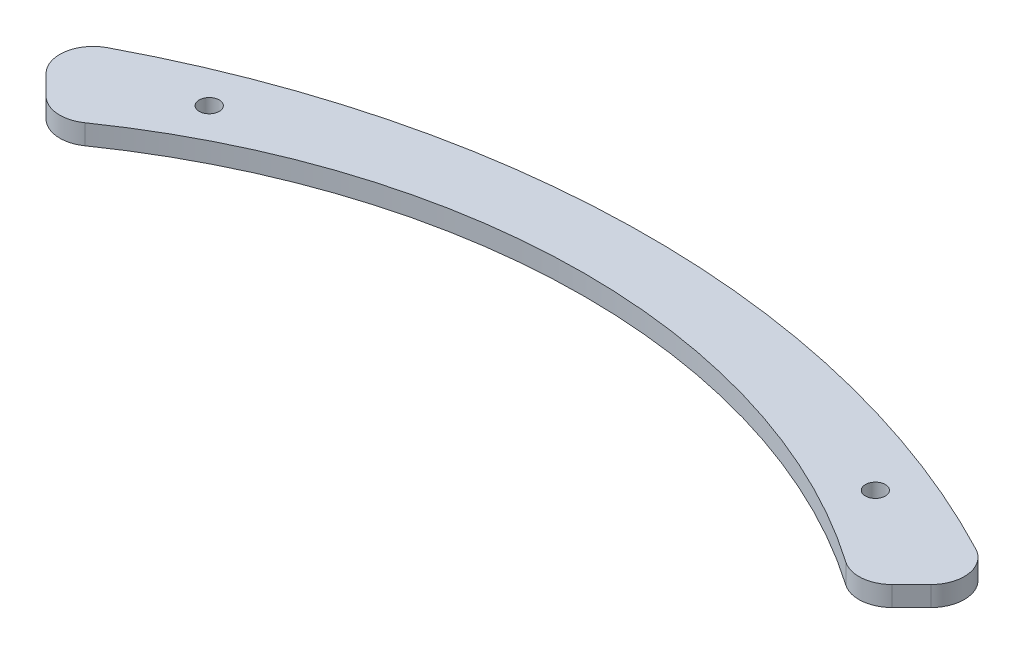
from build123d import *

# Parameters (mm, degrees)
BOSS_EXTRUDE1_DEPTH = 3
FILLET1_R           = 5
CUT_EXTRUDE1_REACH  = 157.621
SKETCH2_R           = 1.5


with BuildPart() as part:
    # Sketch1 → Boss-Extrude1 (new body)
    with BuildSketch(Plane(origin=(0, 0, 0), x_dir=(1, 0, 0), z_dir=(0, 1, 0))):
        with BuildLine():
            Line((-71.102710222, 120.600184905), (-60.496108504, 109.993583187))
            ThreePointArc((-60.496108504, 109.993583187), (0, 130.368079384), (60.496108504, 109.993583187))
            Line((60.496108504, 109.993583187), (71.102710222, 120.600184905))
            ThreePointArc((71.102710222, 120.600184905), (0, 140), (-71.102710222, 120.600184905))
        make_face()
    extrude(amount=BOSS_EXTRUDE1_DEPTH)

    # Fillet1
    fillet1_edges = [part.edges().sort_by_distance(p)[0] for p in [
        (71.102710222, 1.5, -120.600184905),
        (60.496108504, 1.5, -109.993583187),
        (-71.102710222, 1.5, -120.600184905),
        (-60.496108504, 1.5, -109.993583187),
    ]]
    fillet(fillet1_edges, radius=FILLET1_R)

    # Sketch2 → Cut-Extrude1 (cut, up to next)
    with BuildSketch(Plane(origin=(0, 3, 0), x_dir=(1, 0, 0), z_dir=(0, 1, 0)), mode=Mode.PRIVATE) as cut_extrude1_sk1:
        with Locations((-50, 124)):
            Circle(SKETCH2_R)
    cut_extrude1_tool1 = extrude(cut_extrude1_sk1.sketch, amount=-CUT_EXTRUDE1_REACH, mode=Mode.PRIVATE) & part.part
    # Sketch2 → Cut-Extrude1 (cut, up to next)
    with BuildSketch(Plane(origin=(0, 3, 0), x_dir=(1, 0, 0), z_dir=(0, 1, 0)), mode=Mode.PRIVATE) as cut_extrude1_sk2:
        with Locations((50, 124)):
            Circle(SKETCH2_R)
    cut_extrude1_tool2 = extrude(cut_extrude1_sk2.sketch, amount=-CUT_EXTRUDE1_REACH, mode=Mode.PRIVATE) & part.part
    add(cut_extrude1_tool1.solids().sort_by_distance((-50, 3, -124))[0], mode=Mode.SUBTRACT)
    add(cut_extrude1_tool2.solids().sort_by_distance((50, 3, -124))[0], mode=Mode.SUBTRACT)


solid = part.part
